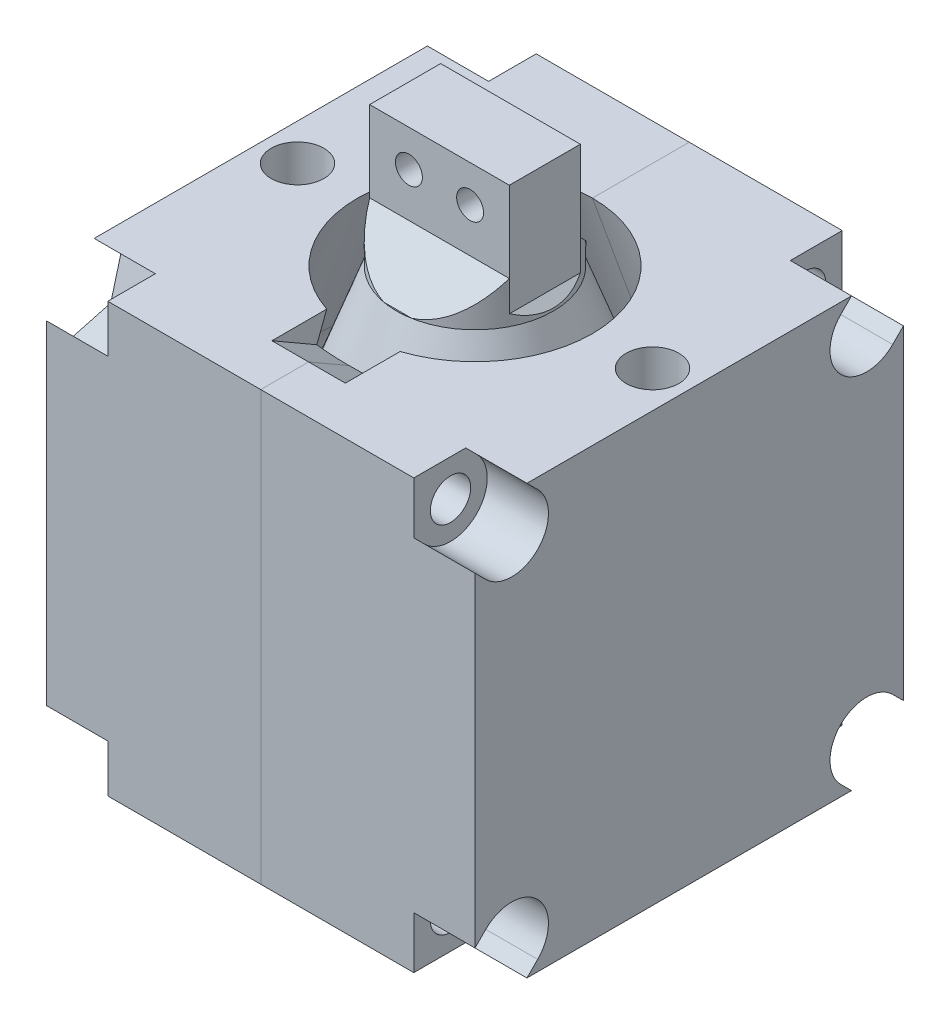
from build123d import *
from build123d.topology import SkipClean

# Parameters (mm, degrees)
BOSS_EXTRUDE1_DEPTH = 35
BOSS_EXTRUDE2_DEPTH = 10
CHAMFER1_SIZE       = 1
BOSS_EXTRUDE3_DEPTH = 10.80130834
SKETCH9_R           = 1.6500000000000006
SKETCH9_R_2         = 1.6499999999999986
CUT_EXTRUDE1_DEPTH  = 9.99
BOSS_EXTRUDE5_DEPTH = 9.99
CUT_EXTRUDE3_DEPTH  = 3
SKETCH12_R          = 1.6500000000000001
SKETCH12_R_2        = 1.6499999999999986
SKETCH12_R_3        = 1.6500000000000006
SKETCH12_R_4        = 1.6500000000000024
CUT_EXTRUDE4_DEPTH  = 60.634302209382824
CUT_EXTRUDE5_DEPTH  = 5
CUT_EXTRUDE6_DEPTH  = 5
SKETCH15_R          = 2.1499999999999995
SKETCH15_R_2        = 2.1499999999999977
CUT_EXTRUDE7_DEPTH  = 5
SKETCH17_R          = 18.633796548331432
CUT_EXTRUDE9_DEPTH  = 43.874235853248756
SKETCH18_W          = 11.4119890999963
SKETCH18_H          = 5.800000000000001
BOSS_EXTRUDE6_DEPTH = 10
CHAMFER2_SIZE       = 0.9
CHAMFER3_SIZE       = 3.4
SKETCH19_R          = 1.0999999999999992
CUT_EXTRUDE10_DEPTH = 53.424327368121766


# Read off the part's stored shape, not the designer's step: Split1
with BuildPart() as part:
    # Sketch1 → Boss-Extrude1 (new body)
    with BuildSketch(Plane(origin=(0, 0, 0), x_dir=(1, 0, 0), z_dir=(0, 1, 0))):
        Polygon((-17.500000000000004, 17.5), (17.499999999999996, 17.5), (17.5, -17.5), (-17.5, -17.5), align=None)
    extrude(amount=BOSS_EXTRUDE1_DEPTH)

    # Sketch4 → Cut-Revolve2 (revolve, cut)
    with BuildSketch(Plane.XY, mode=Mode.PRIVATE) as cut_revolve2_sk:
        with BuildLine():
            Line((-6.74e-15, 32.5), (3.06e-15, 2.5000000000000004))
            ThreePointArc((3.06e-15, 2.5000000000000004), (-12.287280664334899, 8.896353454734333), (-14.095389311788608, 22.63030214988509))
            Line((-14.095389311788608, 22.63030214988509), (-9.593187487480089, 35))
            Line((-9.593187487480089, 35), (0, 35))
            Line((0, 35), (-6.74e-15, 32.5))
        make_face()
    revolve(cut_revolve2_sk.sketch.rotate(Axis((0, 36.75000000000001, 0), (0, -1, 0)), 270), axis=Axis((0, 36.75000000000001, 0), (0, -1, 0)), mode=Mode.SUBTRACT)

    # Sketch11 → Cut-Extrude3 (cut, symmetric)
    with BuildSketch(Plane(origin=(0, 0, 0), x_dir=(0, 0, -1), z_dir=(1, 0, 0))):
        Polygon((-13.59318748748009, 35), (-8.59318748748009, 35), (-9.46142837581474, 32.61452776465336), align=None)
    extrude(amount=CUT_EXTRUDE3_DEPTH, both=True, mode=Mode.SUBTRACT)

    # Sketch12 → Cut-Extrude4 (cut, through all)
    with BuildSketch(Plane(origin=(17.5, 0, -1.73e-15), x_dir=(-2.8e-16, 0, -1), z_dir=(1, 0, -2.8e-16))):
        with Locations((-14.499999999999998, 32)):
            Circle(SKETCH12_R)
        with Locations(Location((14.499999999999998, 32, 0), (0, 0, 180))):
            Circle(SKETCH12_R_2)
        with Locations((-14.500000000000005, 2.9999999999999956)):
            Circle(SKETCH12_R_3)
        with Locations(Location((14.500000000000005, 2.9999999999999956, 0), (0, 0, 180))):
            Circle(SKETCH12_R_4)
    extrude(amount=-CUT_EXTRUDE4_DEPTH, mode=Mode.SUBTRACT)

    # Sketch13 → Cut-Extrude5 (cut)
    with BuildSketch(Plane(origin=(17.5, 0, -1.73e-15), x_dir=(-2.8e-16, 0, -1), z_dir=(1, 0, -2.8e-16))):
        with BuildLine():
            Line((-16.621320343559642, 29.878679656440358), (-17.5, 30.75735931288072))
            Line((-17.5, 30.75735931288072), (-17.5, 35))
            Line((-17.5, 35), (-13.257359312880714, 35))
            Line((-13.257359312880714, 35), (-12.378679656440353, 34.121320343559645))
            ThreePointArc((-12.378679656440353, 34.121320343559645), (-12.378679656440356, 29.878679656440358), (-16.621320343559642, 29.878679656440358))
        make_face()
        with BuildLine():
            Line((-13.257359312880714, 0), (-12.378679656440353, 0.8786796564403607))
            ThreePointArc((-12.378679656440353, 0.8786796564403607), (-12.378679656440356, 5.121320343559647), (-16.621320343559642, 5.121320343559645))
            Line((-16.621320343559642, 5.121320343559645), (-17.5, 4.242640687119284))
            Line((-17.5, 4.242640687119284), (-17.5, 0))
            Line((-17.5, 0), (-13.257359312880714, 0))
        make_face()
        with BuildLine():
            Line((16.621320343559642, 29.878679656440358), (17.5, 30.75735931288072))
            Line((17.5, 30.75735931288072), (17.5, 35))
            Line((17.5, 35), (13.257359312880714, 35))
            Line((13.257359312880714, 35), (12.378679656440353, 34.121320343559645))
            ThreePointArc((12.378679656440353, 34.121320343559645), (12.378679656440355, 29.878679656440358), (16.621320343559642, 29.878679656440358))
        make_face()
        with BuildLine():
            Line((16.621320343559642, 5.121320343559645), (17.5, 4.242640687119284))
            Line((17.5, 4.242640687119284), (17.5, 0))
            Line((17.5, 0), (13.257359312880714, 0))
            Line((13.257359312880714, 0), (12.378679656440353, 0.8786796564403607))
            ThreePointArc((12.378679656440353, 0.8786796564403607), (12.378679656440356, 5.121320343559647), (16.621320343559642, 5.121320343559645))
        make_face()
    extrude(amount=-CUT_EXTRUDE5_DEPTH, mode=Mode.SUBTRACT)

    # Sketch14 → Cut-Extrude6 (cut)
    with BuildSketch(Plane.ZY.offset(17.5)):
        Polygon((-17.56722644703862, 31.17813915051261), (-15.321860849487372, 28.93277355296138), (-12.254634402448755, 29.754634402448765), (-11.432773552961383, 32.821860849487386), (-13.678139150512607, 35.06722644703862), (-15.555456351737007, 36.94454364826299), (-19.444543648263, 33.05545635173699), align=None)
        Polygon((-19.444543648263, 1.9445436482630112), (-15.555456351737007, -1.9445436482629967), (-13.678139150512637, -0.06722644703862496), (-11.432773552961358, 2.1781391505126066), (-12.254634402448742, 5.245365597551246), (-15.321860849487372, 6.0672264470386255), (-17.56722644703862, 3.8218608494873934), align=None)
        Polygon((17.56722644703862, 3.8218608494873934), (19.444543648263, 1.9445436482630127), (15.555456351737007, -1.9445436482629919), (13.678139150512637, -0.06722644703862496), (11.432773552961383, 2.1781391505126186), (12.254634402448755, 5.245365597551239), (15.321860849487372, 6.067226447038624), align=None)
        Polygon((19.444543648263, 33.05545635173699), (15.555456351737007, 36.94454364826299), (13.678139150512637, 35.06722644703863), (11.432773552961383, 32.821860849487386), (12.254634402448755, 29.754634402448765), (15.321860849487372, 28.93277355296138), (17.56722644703862, 31.17813915051261), align=None)
    extrude(amount=-CUT_EXTRUDE6_DEPTH, mode=Mode.SUBTRACT)

    # Sketch15 → Cut-Extrude7 (cut)
    with BuildSketch(Plane(origin=(0, 35, 0), x_dir=(1, 0, 0), z_dir=(0, 1, 0))):
        with Locations(Location((-14.500000000000005, 0, 0), (0, 0, 270))):
            Circle(SKETCH15_R)
        with Locations(Location((14.500000000000005, 0, 0), (0, 0, 270))):
            Circle(SKETCH15_R_2)
    extrude(amount=-CUT_EXTRUDE7_DEPTH, mode=Mode.SUBTRACT)


with BuildPart() as body_2:
    # Sketch5 → Revolve1 (revolve)
    with BuildSketch(Plane.XY):
        with BuildLine():
            ThreePointArc((-11.276311449430883, 21.604241719908067), (-10.618754960877792, 11.910541790045011), (-3, 5.881049961377751))
            ThreePointArc((-3, 5.881049961377751), (-1.5120515097927365, 5.595643644794), (2.39e-15, 5.500000000000002))
            Line((2.39e-15, 5.500000000000002), (0, 35))
            Line((0, 35), (-6.400654170052348, 35))
            Line((-6.400654170052348, 35), (-7.492564872850967, 32))
            Line((-7.492564872850967, 32), (-11.276311449430883, 21.604241719908067))
        make_face()
    revolve(axis=Axis((0, 36.75000000000001, 0), (0, -1, 0)))

    # Sketch7 → Boss-Extrude2 (add)
    with BuildSketch(Plane(origin=(0, 35, 0), x_dir=(1, 0, 0), z_dir=(0, 1, 0))):
        with BuildLine():
            Line((-3.4353032384499476, 5.400654170052349), (3.4353032384499493, 5.4006541700523485))
            ThreePointArc((3.4353032384499493, 5.4006541700523485), (6.400654170052353, -4.3e-16), (3.4353032384499493, -5.4006541700523485))
            Line((3.4353032384499493, -5.4006541700523485), (-3.4353032384499476, -5.400654170052349))
            ThreePointArc((-3.4353032384499476, -5.400654170052349), (-6.400654170052346, 3.5e-16), (-3.4353032384499476, 5.400654170052349))
        make_face()
    extrude(amount=BOSS_EXTRUDE2_DEPTH)

    # Chamfer1
    # the kernel refuses this chamfer: 1 mm, written as the material it adds along each edge
    with BuildSketch(Plane(origin=(6.006986226415867, 35, 5.4006541700523485), x_dir=(0, -0.02749587661058907, 0.9996219169112965), z_dir=(-1, 0, 1.3e-16))) as chamfer1_piece_1_section:
        Polygon((CHAMFER1_SIZE * 0.999621916911, CHAMFER1_SIZE * 0.0274958766106), (-CHAMFER1_SIZE * 0.0274958766106, CHAMFER1_SIZE * 0.999621916911), (0, 0), align=None)
    chamfer1_piece_1 = extrude(amount=12.013972452831732, mode=Mode.PRIVATE)
    chamfer1_piece_1 = chamfer1_piece_1 & Plane(origin=(6.22e-15, 35.48065445731911, -2.2e-16), x_dir=(-0.5367112715639589, 0, 0.8437659693162545), z_dir=(0, -1, 0)) * Cylinder(6.400654170052352, 29, mode=Mode.PRIVATE)
    add(chamfer1_piece_1)
    with BuildSketch(Plane(origin=(-6.006986226415865, 35, -5.400654170052349), x_dir=(0, -0.02749587661058907, -0.9996219169112965), z_dir=(1, 0, 1.3e-16))) as chamfer1_piece_2_section:
        Polygon((CHAMFER1_SIZE * 0.999621916911, CHAMFER1_SIZE * 0.0274958766106), (-CHAMFER1_SIZE * 0.0274958766106, CHAMFER1_SIZE * 0.999621916911), (0, 0), align=None)
    chamfer1_piece_2 = extrude(amount=12.013972452831732, mode=Mode.PRIVATE)
    chamfer1_piece_2 = chamfer1_piece_2 & Plane(origin=(6.22e-15, 35.48065445732004, -2.2e-16), x_dir=(-0.5367112715639589, 0, 0.8437659693162545), z_dir=(0, -1, 0)) * Cylinder(6.400654170052352, 29, mode=Mode.PRIVATE)
    add(chamfer1_piece_2)

    # Sketch8 → Boss-Extrude3 (add)
    with BuildSketch(Plane.XY.offset(5.400654170052349)):
        Polygon((17.5, 45.000000000000014), (-17.5, 45.00000000000001), (-17.5, 35.010000000000005), (-9.593187487480089, 35.01000000000001), (-9.593187487480089, 39.00000000000001), (9.593187487480089, 39.00000000000001), (9.593187487480089, 35.01000000000001), (17.5, 35.01000000000001), align=None)
    extrude(amount=-BOSS_EXTRUDE3_DEPTH)

    # Sketch9 → Cut-Extrude1 (cut)
    with BuildSketch(Plane(origin=(0, 45.00000000000001, 0), x_dir=(1, 0, 0), z_dir=(0, 1, 0))):
        with Locations(Location((-14.500000000000005, 0, 0), (0, 0, 270))):
            Circle(SKETCH9_R)
        with Locations(Location((14.500000000000005, 0, 0), (0, 0, 90))):
            Circle(SKETCH9_R_2)
    extrude(amount=-CUT_EXTRUDE1_DEPTH, mode=Mode.SUBTRACT)

    # Sketch10 → Boss-Extrude5 (add)
    with BuildSketch(Plane(origin=(0, 45.00000000000001, 0), x_dir=(1, 0, 0), z_dir=(0, 1, 0))):
        Polygon((-17.500000000000004, 5.4006541700523565), (-9.593187487480089, 5.400654170052356), (-9.593187487480089, 6.4006541700523565), (-17.499999999999996, 6.4006541700523565), align=None)
        Polygon((-17.499999999999996, -6.4006541700523565), (-9.593187487480089, -6.4006541700523565), (-9.593187487480089, -5.400654170052356), (-17.500000000000004, -5.4006541700523565), align=None)
        Polygon((17.500000000000004, -5.4006541700523565), (17.499999999999996, -6.4006541700523565), (9.593187487480089, -6.4006541700523565), (9.593187487480089, -5.400654170052356), align=None)
        Polygon((17.499999999999996, 6.4006541700523565), (9.593187487480089, 6.4006541700523565), (9.593187487480089, 5.400654170052356), (17.500000000000004, 5.4006541700523565), align=None)
    extrude(amount=-BOSS_EXTRUDE5_DEPTH)

    # Sketch17 → Cut-Extrude9 (cut, through all)
    with BuildSketch(Plane.XZ.offset(-35.01000000000001)):
        Circle(SKETCH17_R)
    extrude(amount=-CUT_EXTRUDE9_DEPTH, mode=Mode.SUBTRACT)

    # Sketch18 → Boss-Extrude6 (add)
    with BuildSketch(Plane(origin=(0, 35.01000000000001, 0), x_dir=(1, 0, 0), z_dir=(0, 1, 0))):
        Rectangle(SKETCH18_W, SKETCH18_H)
    extrude(amount=BOSS_EXTRUDE6_DEPTH)

    # Chamfer2
    # the kernel refuses this chamfer: 0.9 mm, written as the material it adds along each edge
    with BuildSketch(Plane(origin=(5.705994549998151, 35.01000000000001, 2.9), x_dir=(-0.027495876610586382, 0.9996219169112966, 0), z_dir=(0, 0, -1))) as chamfer2_piece_1_section:
        Polygon((CHAMFER2_SIZE * 0.999621916911, CHAMFER2_SIZE * 0.0274958766106), (-CHAMFER2_SIZE * 0.0274958766106, CHAMFER2_SIZE * 0.999621916911), (0, 0), align=None)
    chamfer2_piece_1 = extrude(amount=5.8, mode=Mode.PRIVATE)
    chamfer2_piece_1 = chamfer2_piece_1 & Plane(origin=(8.88e-15, 35.351553845275, 0), x_dir=(0.5367112715639574, 0, -0.8437659693162554), z_dir=(0, -1, 0)) * Cylinder(6.400654170052345, 16, mode=Mode.PRIVATE)
    add(chamfer2_piece_1)
    with BuildSketch(Plane(origin=(-5.705994549998149, 35.01000000000001, -2.9), x_dir=(-0.9996219169112966, -0.0274958766105883, 0), z_dir=(0, 0, 1))) as chamfer2_piece_2_section:
        Polygon((CHAMFER2_SIZE * 0.999621916911, -CHAMFER2_SIZE * 0.0274958766106), (-CHAMFER2_SIZE * 0.0274958766106, -CHAMFER2_SIZE * 0.999621916911), (0, 0), align=None)
    chamfer2_piece_2 = extrude(amount=5.8, mode=Mode.PRIVATE)
    chamfer2_piece_2 = chamfer2_piece_2 & Plane(origin=(0, 35.35155387144908, 0), x_dir=(-0.5367112715641034, 0, 0.8437659693161625), z_dir=(0, -1, 0)) * Cylinder(6.400654170052, 16, mode=Mode.PRIVATE)
    add(chamfer2_piece_2)

    # Chamfer3
    # the kernel refuses this chamfer: 3.4 mm, written as the material it adds along each edge
    with BuildSketch(Plane(origin=(14.449716709082246, 35.01000000000001, -2.9), x_dir=(0, 0.9996219169112968, 0.027495876610586365), z_dir=(-1, 0, 0))) as chamfer3_piece_1_section:
        Polygon((CHAMFER3_SIZE * 0.999621916911, CHAMFER3_SIZE * 0.0274958766106), (-CHAMFER3_SIZE * 0.0274958766106, CHAMFER3_SIZE * 0.999621916911), (0, 0), align=None)
    chamfer3_piece_1 = extrude(amount=28.89943341816449, mode=Mode.PRIVATE)
    chamfer3_piece_1 = chamfer3_piece_1 & Plane(origin=(0, 37.40805588236936, 0), x_dir=(-0.5367112715641034, 0, 0.8437659693161625), z_dir=(0, -1, 0)) * Cylinder(6.400654170052, 72, mode=Mode.PRIVATE)
    add(chamfer3_piece_1)
    with BuildSketch(Plane(origin=(-14.449716709082244, 35.01000000000001, 2.9), x_dir=(0, 0.9996219169112968, -0.027495876610586365), z_dir=(1, 0, 0))) as chamfer3_piece_2_section:
        Polygon((CHAMFER3_SIZE * 0.999621916911, CHAMFER3_SIZE * 0.0274958766106), (-CHAMFER3_SIZE * 0.0274958766106, CHAMFER3_SIZE * 0.999621916911), (0, 0), align=None)
    chamfer3_piece_2 = extrude(amount=28.89943341816449, mode=Mode.PRIVATE)
    chamfer3_piece_2 = chamfer3_piece_2 & Plane(origin=(0, 37.40805588270253, 0), x_dir=(-0.5367112715641034, 0, 0.8437659693161625), z_dir=(0, -1, 0)) * Cylinder(6.400654170052, 72, mode=Mode.PRIVATE)
    add(chamfer3_piece_2)

    # Sketch19 → Cut-Extrude10 (cut, through all)
    with SkipClean():  # the faces are left unmerged after this step: merging them gives an invalid solid
        with BuildSketch(Plane.XY.offset(2.9)):
            with Locations((-2.4999999999999853, 42.010000000002044)):
                Circle(SKETCH19_R)
            with Locations((2.499999999999987, 42.010000000002044)):
                Circle(SKETCH19_R)
        extrude(amount=-CUT_EXTRUDE10_DEPTH, mode=Mode.SUBTRACT)


with BuildPart() as body_3:
    # Split1: the piece on the far side of the plane
    add(part.part)
    split(bisect_by=Plane.YZ, keep=Keep.BOTTOM)


with BuildPart() as part_1:
    add(part.part)

    # Split1
    split(bisect_by=Plane.YZ, keep=Keep.TOP)


solid = Compound([body_2.part, body_3.part, part_1.part])
